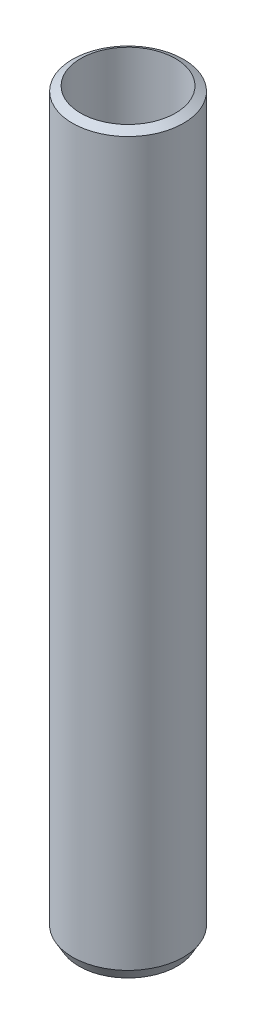
from build123d import *

# Parameters (mm, degrees)
SKETCH1_R           = 45
BOSS_EXTRUDE1_DEPTH = 600
SKETCH2_R           = 38.423285368
CUT_EXTRUDE1_DEPTH  = 604.365560834
CHAMFER1_SIZE       = 5.219704
CHAMFER1_SIZE_2     = 9.040792


with BuildPart() as part:
    # Sketch1 → Boss-Extrude1 (new body)
    with BuildSketch(Plane(origin=(0, 0, 0), x_dir=(1, 0, 0), z_dir=(0, 1, 0))):
        with Locations(Location((0, 0, 0), (0, 0, 270))):
            Circle(SKETCH1_R)
    extrude(amount=BOSS_EXTRUDE1_DEPTH)

    # Sketch2 → Cut-Extrude1 (cut, through all)
    with BuildSketch(Plane(origin=(0, 0, 0), x_dir=(1, 0, 0), z_dir=(0, 1, 0))):
        with Locations(Location((0, 0, 0), (0, 0, 270))):
            Circle(SKETCH2_R)
    extrude(amount=CUT_EXTRUDE1_DEPTH, mode=Mode.SUBTRACT)

    # Chamfer1
    # the kernel refuses this chamfer: 9.040792, 5.219704 mm, written as the material it takes off along each edge
    with BuildSketch(Plane(origin=(0, 600, 0), x_dir=(0, 0, 1), z_dir=(-1, 0, 0))) as chamfer1_piece_1:
        Polygon((45, -CHAMFER1_SIZE), (45 - CHAMFER1_SIZE_2, 0), (45, 0), align=None)
    revolve(axis=Axis((0, 600, 0), (0, 1, 0)), mode=Mode.SUBTRACT)
    with BuildSketch(Plane(origin=(0, 0, 0), x_dir=(0, 0, 1), z_dir=(-1, 0, 0))) as chamfer1_piece_2:
        Polygon((45, CHAMFER1_SIZE_2), (45 - CHAMFER1_SIZE, 0), (45, 0), align=None)
    revolve(axis=Axis((0, 0, 0), (0, 1, 0)), mode=Mode.SUBTRACT)


solid = part.part
